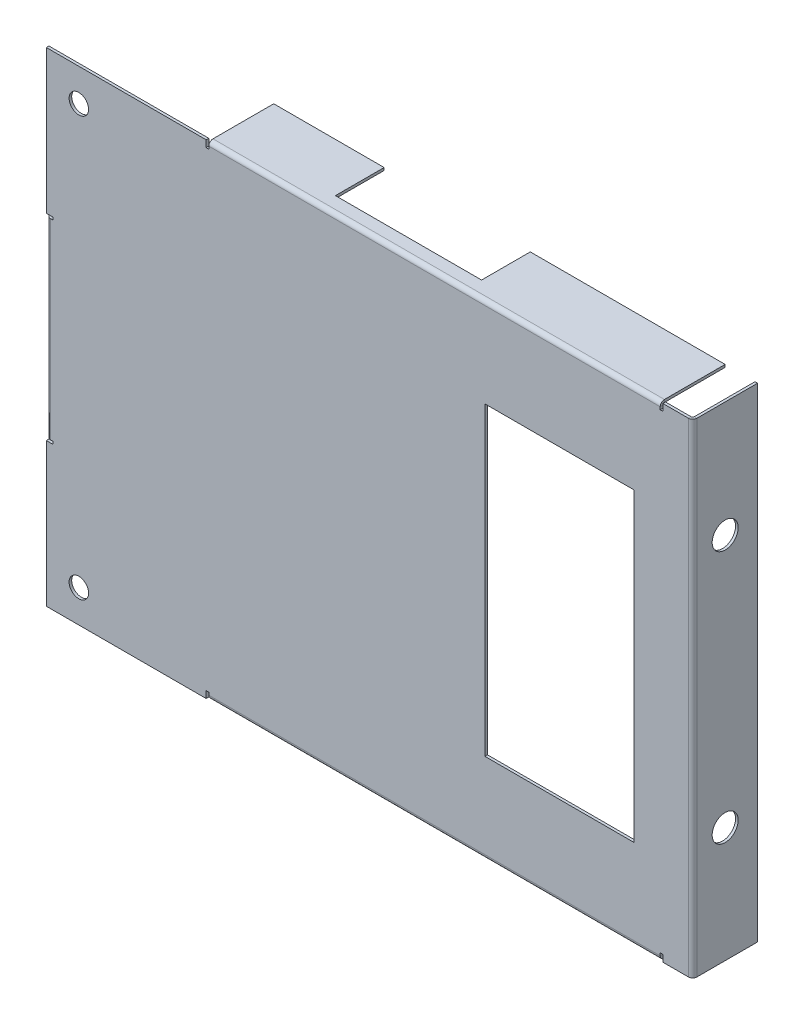
from build123d import *

# Parameters (mm, degrees)
SKETCH_1_W                        = 199
SKETCH_1_H                        = 149
SKETCH_1_R                        = 3
SKETCH_1_W_2                      = 46
SKETCH_1_H_2                      = 94
SM_BASE_FLANGE_1_DEPTH            = 0.8
SM_EDGE_FLANGE_1_STRIP_W          = 4.2
SM_EDGE_FLANGE_1_STRIP_H          = 0.8
SM_EDGE_FLANGE_1_STRIP_CUT_DEPTH  = 59
SM_EDGE_FLANGE_1_RELIEF_W         = 5
SM_EDGE_FLANGE_1_RELIEF_H         = 0.8
SM_EDGE_FLANGE_1_RELIEF_CUT_DEPTH = 0.8
SM_EDGE_FLANGE_1_DEPTH            = 59
SM_EDGE_FLANGE_3_STRIP_W          = 4.2
SM_EDGE_FLANGE_3_STRIP_H          = 0.8
SM_EDGE_FLANGE_3_STRIP_CUT_DEPTH  = 139
SM_EDGE_FLANGE_3_RELIEF_W         = 5
SM_EDGE_FLANGE_3_RELIEF_H         = 0.8
SM_EDGE_FLANGE_3_RELIEF_CUT_DEPTH = 0.8
SM_EDGE_FLANGE_3_DEPTH            = 139
SM_EDGE_FLANGE_3_FLAT_DEPTH       = 0.8
SM_EDGE_FLANGE_4_STRIP_W          = 4.2
SM_EDGE_FLANGE_4_STRIP_H          = 0.8
SM_EDGE_FLANGE_4_STRIP_CUT_DEPTH  = 139
SM_EDGE_FLANGE_4_RELIEF_W         = 5
SM_EDGE_FLANGE_4_RELIEF_H         = 0.8
SM_EDGE_FLANGE_4_RELIEF_CUT_DEPTH = 0.8
SM_EDGE_FLANGE_4_DEPTH            = 139
SM_EDGE_FLANGE_4_FLAT_DEPTH       = 0.8
SM_EDGE_FLANGE_5_STRIP_W          = 4.2
SM_EDGE_FLANGE_5_STRIP_H          = 0.8
SM_EDGE_FLANGE_5_STRIP_CUT_DEPTH  = 149
SM_EDGE_FLANGE_5_DEPTH            = 149
SKETCH_21_R                       = 4
CUT_EXTRUDE_1_DEPTH               = 214.427388121


# Sheet-metal steps are written as plain solids
with BuildPart() as part:
    # Sketch 1 → 基体-法兰1 (new body)
    with BuildSketch(Plane.XY):
        Rectangle(SKETCH_1_W, SKETCH_1_H)
        with Locations((-89.5, 64.5)):
            Circle(SKETCH_1_R, mode=Mode.SUBTRACT)
        with Locations((-89.5, -64.5)):
            Circle(SKETCH_1_R, mode=Mode.SUBTRACT)
        with Locations((58.5, 0)):
            Rectangle(SKETCH_1_W_2, SKETCH_1_H_2, mode=Mode.SUBTRACT)
    extrude(amount=-SM_BASE_FLANGE_1_DEPTH)

    # 边线-法兰1 strip (across the edge) → 边线-法兰1 strip cut (cut)
    with BuildSketch(Plane(origin=(-99.5, -29.5, -0.8), x_dir=(1, 0, 0), z_dir=(0, 1, 0))):
        with Locations((-0.8, -0.4)):
            Rectangle(SM_EDGE_FLANGE_1_STRIP_W, SM_EDGE_FLANGE_1_STRIP_H)
    extrude(amount=SM_EDGE_FLANGE_1_STRIP_CUT_DEPTH, mode=Mode.SUBTRACT)

    # 边线-法兰1 relief (on the sheet) → 边线-法兰1 relief cut (cut)
    with BuildSketch(Plane(origin=(-98.2, -29.5, -0.8), x_dir=(1, 0, 0), z_dir=(0, 0, -1))):
        with Locations((-1.7, 0.4)):
            Rectangle(SM_EDGE_FLANGE_1_RELIEF_W, SM_EDGE_FLANGE_1_RELIEF_H)
        with Locations((-1.7, -59.4)):
            Rectangle(SM_EDGE_FLANGE_1_RELIEF_W, SM_EDGE_FLANGE_1_RELIEF_H)
    extrude(amount=-SM_EDGE_FLANGE_1_RELIEF_CUT_DEPTH, mode=Mode.SUBTRACT)

    # 边线-法兰1 section (across the edge) → 边线-法兰1 (add)
    with BuildSketch(Plane(origin=(-99.5, -29.5, -0.8), x_dir=(1, 0, 0), z_dir=(0, 1, 0))):
        with BuildLine():
            Line((0, 0.5), (0, 19.2))
            Line((0, 19.2), (0.8, 19.2))
            Line((0.8, 19.2), (0.8, 0.5))
            ThreePointArc((0.8, 0.5), (0.946446609, 0.146446609), (1.3, 0))
            Line((1.3, 0), (1.3, -0.8))
            ThreePointArc((1.3, -0.8), (0.380761184, -0.419238816), (0, 0.5))
        make_face()
    extrude(amount=SM_EDGE_FLANGE_1_DEPTH)

    # 边线-法兰3 strip (across the edge) → 边线-法兰3 strip cut (cut)
    with BuildSketch(Plane(origin=(89.5, -74.5, -0.8), x_dir=(0, 1, 0), z_dir=(-1, 0, 0))):
        with Locations((-0.8, -0.4)):
            Rectangle(SM_EDGE_FLANGE_3_STRIP_W, SM_EDGE_FLANGE_3_STRIP_H)
    extrude(amount=SM_EDGE_FLANGE_3_STRIP_CUT_DEPTH, mode=Mode.SUBTRACT)

    # 边线-法兰3 relief (on the sheet) → 边线-法兰3 relief cut (cut)
    with BuildSketch(Plane(origin=(89.5, -73.2, -0.8), x_dir=(0, 1, 0), z_dir=(0, 0, -1))):
        with Locations((-1.7, 0.4)):
            Rectangle(SM_EDGE_FLANGE_3_RELIEF_W, SM_EDGE_FLANGE_3_RELIEF_H)
        with Locations((-1.7, -139.4)):
            Rectangle(SM_EDGE_FLANGE_3_RELIEF_W, SM_EDGE_FLANGE_3_RELIEF_H)
    extrude(amount=-SM_EDGE_FLANGE_3_RELIEF_CUT_DEPTH, mode=Mode.SUBTRACT)

    # 边线-法兰3 bend section (across the edge) → 边线-法兰3 (add)
    with BuildSketch(Plane(origin=(89.5, -74.5, -0.8), x_dir=(0, 1, 0), z_dir=(-1, 0, 0))):
        with BuildLine():
            Line((0, 0.5), (0.8, 0.5))
            ThreePointArc((0.8, 0.5), (0.946446609, 0.146446609), (1.3, 0))
            Line((1.3, 0), (1.3, -0.8))
            ThreePointArc((1.3, -0.8), (0.380761184, -0.419238816), (0, 0.5))
        make_face()
    extrude(amount=SM_EDGE_FLANGE_3_DEPTH)

    # 边线-法兰3 profile (on flange) → 边线-法兰3 flat (add)
    with BuildSketch(Plane(origin=(0, -74.5, -0.8), x_dir=(-1, 0, 0), z_dir=(0, -1, 0))):
        Polygon((49.5, 0.5), (49.5, 19.2), (15.5, 19.2), (15.5, 4.2), (-29.5, 4.2), (-29.5, 19.2), (-89.5, 19.2), (-89.5, 0.5), align=None)
    extrude(amount=-SM_EDGE_FLANGE_3_FLAT_DEPTH)

    # 边线-法兰4 strip (across the edge) → 边线-法兰4 strip cut (cut)
    with BuildSketch(Plane(origin=(-49.5, 74.5, -0.8), x_dir=(0, -1, 0), z_dir=(1, 0, 0))):
        with Locations((-0.8, -0.4)):
            Rectangle(SM_EDGE_FLANGE_4_STRIP_W, SM_EDGE_FLANGE_4_STRIP_H)
    extrude(amount=SM_EDGE_FLANGE_4_STRIP_CUT_DEPTH, mode=Mode.SUBTRACT)

    # 边线-法兰4 relief (on the sheet) → 边线-法兰4 relief cut (cut)
    with BuildSketch(Plane(origin=(-49.5, 73.2, -0.8), x_dir=(0, -1, 0), z_dir=(0, 0, -1))):
        with Locations((-1.7, 0.4)):
            Rectangle(SM_EDGE_FLANGE_4_RELIEF_W, SM_EDGE_FLANGE_4_RELIEF_H)
        with Locations((-1.7, -139.4)):
            Rectangle(SM_EDGE_FLANGE_4_RELIEF_W, SM_EDGE_FLANGE_4_RELIEF_H)
    extrude(amount=-SM_EDGE_FLANGE_4_RELIEF_CUT_DEPTH, mode=Mode.SUBTRACT)

    # 边线-法兰4 bend section (across the edge) → 边线-法兰4 (add)
    with BuildSketch(Plane(origin=(-49.5, 74.5, -0.8), x_dir=(0, -1, 0), z_dir=(1, 0, 0))):
        with BuildLine():
            Line((0, 0.5), (0.8, 0.5))
            ThreePointArc((0.8, 0.5), (0.946446609, 0.146446609), (1.3, 0))
            Line((1.3, 0), (1.3, -0.8))
            ThreePointArc((1.3, -0.8), (0.380761184, -0.419238816), (0, 0.5))
        make_face()
    extrude(amount=SM_EDGE_FLANGE_4_DEPTH)

    # 边线-法兰4 profile (on flange) → 边线-法兰4 flat (add)
    with BuildSketch(Plane(origin=(0, 74.5, -0.8), x_dir=(1, 0, 0), z_dir=(0, 1, 0))):
        Polygon((89.5, 0.5), (89.5, 19.2), (29.5, 19.2), (29.5, 4.2), (-15.5, 4.2), (-15.5, 19.2), (-49.5, 19.2), (-49.5, 0.5), align=None)
    extrude(amount=-SM_EDGE_FLANGE_4_FLAT_DEPTH)

    # 边线-法兰5 strip (across the edge) → 边线-法兰5 strip cut (cut)
    with BuildSketch(Plane(origin=(99.5, 74.5, -0.8), x_dir=(-1, 0, 0), z_dir=(0, -1, 0))):
        with Locations((-0.8, -0.4)):
            Rectangle(SM_EDGE_FLANGE_5_STRIP_W, SM_EDGE_FLANGE_5_STRIP_H)
    extrude(amount=SM_EDGE_FLANGE_5_STRIP_CUT_DEPTH, mode=Mode.SUBTRACT)

    # 边线-法兰5 section (across the edge) → 边线-法兰5 (add)
    with BuildSketch(Plane(origin=(99.5, 74.5, -0.8), x_dir=(-1, 0, 0), z_dir=(0, -1, 0))):
        with BuildLine():
            Line((0, 0.5), (0, 19.2))
            Line((0, 19.2), (0.8, 19.2))
            Line((0.8, 19.2), (0.8, 0.5))
            ThreePointArc((0.8, 0.5), (0.946446609, 0.146446609), (1.3, 0))
            Line((1.3, 0), (1.3, -0.8))
            ThreePointArc((1.3, -0.8), (0.380761184, -0.419238816), (0, 0.5))
        make_face()
    extrude(amount=SM_EDGE_FLANGE_5_DEPTH)

    # 草图21 → 切除-拉伸1 (cut, through all)
    with BuildSketch(Plane(origin=(99.5, 0, 0), x_dir=(0, 0, -1), z_dir=(1, 0, 0))):
        with Locations((10, -39)):
            Circle(SKETCH_21_R)
        with Locations((10, 39)):
            Circle(SKETCH_21_R)
    extrude(amount=-CUT_EXTRUDE_1_DEPTH, mode=Mode.SUBTRACT)


solid = part.part
